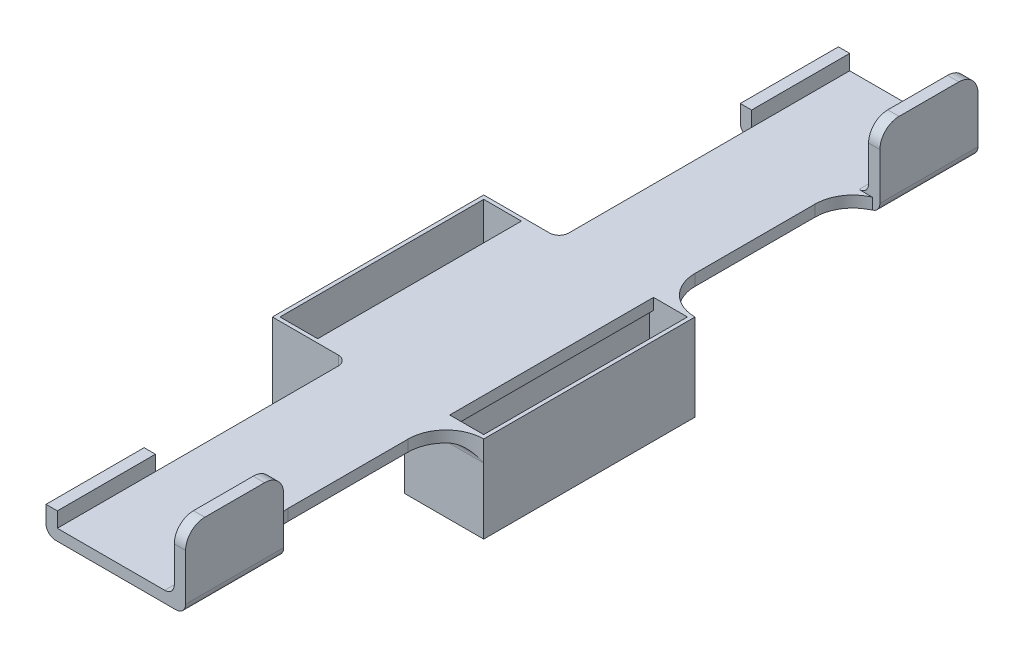
from build123d import *

# Parameters (mm, degrees)
SKETCH1_W                 = 28
SKETCH1_H                 = 28
SKETCH1_W_2               = 27
SKETCH1_H_2               = 27
BOSS_EXTRUDE1_DEPTH       = 5
SKETCH2_W                 = 27
SKETCH2_H                 = 27
BOSS_EXTRUDE2_DEPTH       = 1
SKETCH4_W                 = 7
SKETCH4_H                 = 0.5
CUT_EXTRUDE1_DEPTH        = 4
CUT_EXTRUDE2_DEPTH        = 21.199009877
CUT_EXTRUDE2_DEPTH_BACK   = 21.199009877
SKETCH5_W                 = 5
SKETCH5_H                 = 27
SKETCH7_W                 = 5
SKETCH7_H                 = 27
BOSS_EXTRUDE3_DEPTH       = 4
BOSS_EXTRUDE4_DEPTH       = 5
BOSS_EXTRUDE5_DEPTH       = 5
SKETCH10_W                = 13
SKETCH10_H                = 105
BOSS_EXTRUDE6_DEPTH       = 1.5
SKETCH11_W                = 10
SKETCH11_H                = 28
SKETCH11_W_2              = 5
SKETCH11_H_2              = 27
BOSS_EXTRUDE7_DEPTH       = 1.5
SKETCH12_W                = 3
SKETCH12_H                = 13
BOSS_EXTRUDE8_DEPTH       = 1.5
SKETCH14_W                = 3
SKETCH14_H                = 13
BOSS_EXTRUDE9_DEPTH       = 1.5
FILLET1_R                 = 5
BOSS_EXTRUDE10_DEPTH      = 1
BOSS_EXTRUDE10_DEPTH_BACK = 0.5
SKETCH15_W                = 13
SKETCH15_H                = 10.000000066
FILLET2_R                 = 1.27
FILLET3_R                 = 1.27
FILLET4_R                 = 1.27
FILLET5_R                 = 1.27
SKETCH16_W                = 13
SKETCH16_H                = 3.5
BOSS_EXTRUDE11_DEPTH      = 1.5
FILLET6_R                 = 1.27
FILLET7_R                 = 1.27
FILLET8_R                 = 2.54
CUT_EXTRUDE3_DEPTH        = 1


with BuildPart() as part:
    # Sketch1 → Boss-Extrude1 (new body)
    with BuildSketch(Plane(origin=(0, 0, 0), x_dir=(1, 0, 0), z_dir=(0, 1, 0))):
        Rectangle(SKETCH1_W, SKETCH1_H)
        Rectangle(SKETCH1_W_2, SKETCH1_H_2, mode=Mode.SUBTRACT)
    extrude(amount=BOSS_EXTRUDE1_DEPTH)

    # Sketch4 → Cut-Extrude1 (cut)
    with BuildSketch(Plane.XZ):
        with Locations((0, 13.75)):
            Rectangle(SKETCH4_W, SKETCH4_H)
        with Locations((0, -13.75)):
            Rectangle(SKETCH4_W, SKETCH4_H)
    extrude(amount=-CUT_EXTRUDE1_DEPTH, mode=Mode.SUBTRACT)



with BuildPart() as body_2:
    # Sketch2 → Boss-Extrude2 (new body)
    with BuildSketch(Plane(origin=(0, 5, 0), x_dir=(1, 0, 0), z_dir=(0, 1, 0))):
        Rectangle(SKETCH2_W, SKETCH2_H)
    extrude(amount=-BOSS_EXTRUDE2_DEPTH)

    # Sketch5 → Cut-Extrude2 (cut, two sides: drawn at the far end of the back side and taken through both)
    with BuildSketch(Plane.XZ.offset(-4).offset(-CUT_EXTRUDE2_DEPTH_BACK)):
        with Locations((-11, 0)):
            Rectangle(SKETCH5_W, SKETCH5_H)
        with Locations((11, 0)):
            Rectangle(SKETCH5_W, SKETCH5_H)
    extrude(amount=CUT_EXTRUDE2_DEPTH + CUT_EXTRUDE2_DEPTH_BACK, mode=Mode.SUBTRACT)


with BuildPart() as part_1:
    add(part.part)

    add(body_2.part)  # Boss-Extrude3 merges body 2
    # Sketch7 → Boss-Extrude3 (add)
    with BuildSketch(Plane.XZ.offset(-4)):
        with Locations((-6, 0)):
            Rectangle(SKETCH7_W, SKETCH7_H)
        with Locations((6, 0)):
            Rectangle(SKETCH7_W, SKETCH7_H)
    extrude(amount=BOSS_EXTRUDE3_DEPTH)

    # Sketch8 → Boss-Extrude4 (add)
    with BuildSketch(Plane.XZ):
        Polygon((-13.5, -13.5), (-13.5, 13.5), (-3.5, 13.5), (-3.5, 14), (-14, 14), (-14, -14), (-3.5, -14), (-3.5, -13.5), align=None)
    extrude(amount=BOSS_EXTRUDE4_DEPTH)

    # Sketch9 → Boss-Extrude5 (add)
    with BuildSketch(Plane.XZ):
        Polygon((3.5, 14), (14, 14), (14, -14), (3.5, -14), (3.5, -13.5), (13.5, -13.5), (13.5, 13.5), (3.5, 13.5), align=None)
    extrude(amount=BOSS_EXTRUDE5_DEPTH)

    # Sketch10 → Boss-Extrude6 (add)
    with BuildSketch(Plane(origin=(0, 5, 0), x_dir=(1, 0, 0), z_dir=(0, 1, 0))):
        with Locations((2.5, 0)):
            Rectangle(SKETCH10_W, SKETCH10_H)
    extrude(amount=BOSS_EXTRUDE6_DEPTH)

    # Sketch11 → Boss-Extrude7 (add)
    # profile 1 of 2: a face of its own
    with BuildSketch(Plane(origin=(0, 5, 0), x_dir=(1, 0, 0), z_dir=(0, 1, 0))):
        with Locations((-9, 0)):
            Rectangle(SKETCH11_W, SKETCH11_H)
        with Locations((-11, 0)):
            Rectangle(SKETCH11_W_2, SKETCH11_H_2, mode=Mode.SUBTRACT)
    # profile 2 of 2: a face of its own
    with BuildSketch(Plane(origin=(0, 5, 0), x_dir=(1, 0, 0), z_dir=(0, 1, 0))):
        Polygon((9, 13.5), (9, 14), (14, 14), (14, -14), (9, -14), (9, -13.5), (13.5, -13.5), (13.5, 13.5), align=None)
    extrude(amount=BOSS_EXTRUDE7_DEPTH)

    # Sketch12 → Boss-Extrude8 (add)
    with BuildSketch(Plane(origin=(0, 6.5, 0), x_dir=(1, 0, 0), z_dir=(0, 1, 0))):
        with Locations((10.5, -46)):
            Rectangle(SKETCH12_W, SKETCH12_H)
    extrude(amount=-BOSS_EXTRUDE8_DEPTH)

    # Sketch14 → Boss-Extrude9 (add)
    with BuildSketch(Plane(origin=(0, 6.5, 0), x_dir=(1, 0, 0), z_dir=(0, 1, 0))):
        with Locations((10.5, 46)):
            Rectangle(SKETCH14_W, SKETCH14_H)
    extrude(amount=-BOSS_EXTRUDE9_DEPTH)

    # Fillet1
    # the kernel refuses this fillet: 5 mm, written as the material it adds along each edge
    with BuildSketch(Plane(origin=(9, 6.5, 39.5), x_dir=(0, 0, -1), z_dir=(0, -1, 0))) as fillet1_piece_1:
        with BuildLine():
            CenterArc((4.582575695, 5), FILLET1_R, 203.578178478, 66.421821522)
            Line((0, 3), (-0.091651514, 2.96))
            ThreePointArc((-0.091651514, 2.96), (-0.1, 1.5), (-0.1, 0))
            Line((-0.1, 0), (0, -0.1))
            Line((0, -0.1), (4.582575695, -0.1))
            Line((4.582575695, -0.1), (4.582575695, 0))
        make_face()
    extrude(amount=1.5)
    with BuildSketch(Plane(origin=(9, 5, 14), x_dir=(1, 0, 0), z_dir=(0, 1, 0))) as fillet1_piece_2:
        with BuildLine():
            CenterArc((FILLET1_R, -FILLET1_R), FILLET1_R, 90, 90)
            Line((0, -FILLET1_R), (-FILLET1_R * 0.02, -FILLET1_R))
            Line((-FILLET1_R * 0.02, -FILLET1_R), (-FILLET1_R * 0.02, FILLET1_R * 0.02))
            Line((-FILLET1_R * 0.02, FILLET1_R * 0.02), (FILLET1_R, FILLET1_R * 0.02))
            Line((FILLET1_R, FILLET1_R * 0.02), (FILLET1_R, 0))
        make_face()
    extrude(amount=1.5)
    with BuildSketch(Plane(origin=(9, 5, -14), x_dir=(1, 0, 0), z_dir=(0, 1, 0))) as fillet1_piece_3:
        with BuildLine():
            CenterArc((FILLET1_R, FILLET1_R), FILLET1_R, 180, 90)
            Line((0, FILLET1_R), (-FILLET1_R * 0.02, FILLET1_R))
            Line((-FILLET1_R * 0.02, FILLET1_R), (-FILLET1_R * 0.02, -FILLET1_R * 0.02))
            Line((-FILLET1_R * 0.02, -FILLET1_R * 0.02), (FILLET1_R, -FILLET1_R * 0.02))
            Line((FILLET1_R, -FILLET1_R * 0.02), (FILLET1_R, 0))
        make_face()
    extrude(amount=1.5)
    with BuildSketch(Plane(origin=(9, 6.5, -39.5), x_dir=(0, 0, 1), z_dir=(0, -1, 0))) as fillet1_piece_4:
        with BuildLine():
            CenterArc((4.582575695, -5), FILLET1_R, 90, 66.421821522)
            Line((0, -3), (-0.091651514, -2.96))
            ThreePointArc((-0.091651514, -2.96), (-0.1, -1.5), (-0.1, 0))
            Line((-0.1, 0), (0, 0.1))
            Line((0, 0.1), (4.582575695, 0.1))
            Line((4.582575695, 0.1), (4.582575695, 0))
        make_face()
    extrude(amount=1.5)

    # Sketch15 → Boss-Extrude10 (add, two sides: drawn at the far end of the back side and taken through both)
    with BuildSketch(Plane(origin=(12, 0, 0), x_dir=(0, 0, -1), z_dir=(1, 0, 0)).offset(-BOSS_EXTRUDE10_DEPTH_BACK)):
        with Locations((46, 10.000000033)):
            Rectangle(SKETCH15_W, SKETCH15_H)
        with Locations((-46, 10.000000033)):
            Rectangle(SKETCH15_W, SKETCH15_H)
    extrude(amount=BOSS_EXTRUDE10_DEPTH + BOSS_EXTRUDE10_DEPTH_BACK)

    # Fillet2
    fillet2_edges = [part_1.edges().sort_by_distance(p)[0] for p in [
        (11.5, 6.5, -46),
        (11.5, 6.5, 46),
    ]]
    fillet(fillet2_edges, radius=FILLET2_R)

    # Fillet3
    # the kernel refuses this fillet: 1.27 mm, written as the material it adds along each edge
    with BuildSketch(Plane(origin=(-4, 5, 14), x_dir=(0, 0, 1), z_dir=(1, 0, 0))) as fillet3_piece_1_section:
        with BuildLine():
            CenterArc((FILLET3_R, FILLET3_R), FILLET3_R, 180, 90)
            Line((0, FILLET3_R), (0, 0))
            Line((0, 0), (FILLET3_R, 0))
        make_face()
    fillet3_piece_1 = extrude(amount=18, mode=Mode.PRIVATE)
    fillet3_piece_1 = fillet3_piece_1 - Plane(origin=(14, 4.722255872, 19), x_dir=(1, 0, 0), z_dir=(0, -1, 0)) * Cylinder(5, 42, mode=Mode.PRIVATE)
    fillet3_piece_1 = split(fillet3_piece_1, bisect_by=Plane(origin=(-3.75, 4, 14.285759195), z_dir=(0, 1, 0)), keep=Keep.TOP, mode=Mode.PRIVATE)
    add(fillet3_piece_1)
    with BuildSketch(Plane(origin=(-4, 5, 14), x_dir=(0, 0, 1), z_dir=(1, 0, 0))) as fillet3_piece_2_section:
        with BuildLine():
            CenterArc((FILLET3_R, FILLET3_R), FILLET3_R, 180, 90)
            Line((0, FILLET3_R), (0, 0))
            Line((0, 0), (FILLET3_R, 0))
        make_face()
    fillet3_piece_2 = extrude(amount=21.175, mode=Mode.PRIVATE)
    fillet3_piece_2 = split(fillet3_piece_2, bisect_by=Plane(origin=(-3.5, 3.932655267, 14.008692454), z_dir=(-1, 0, 0)), keep=Keep.TOP, mode=Mode.PRIVATE)
    add(fillet3_piece_2)
    with BuildSketch(Plane(origin=(-7.175, 5, 14), x_dir=(0, 0, 1), z_dir=(1, 0, 0))) as fillet3_piece_3_section:
        with BuildLine():
            CenterArc((FILLET3_R, FILLET3_R), FILLET3_R, 180, 90)
            Line((0, FILLET3_R), (0, 0))
            Line((0, 0), (FILLET3_R, 0))
        make_face()
    fillet3_piece_3 = extrude(amount=21.175, mode=Mode.PRIVATE)
    fillet3_piece_3 = fillet3_piece_3 - Plane(origin=(14, 3.932300045, 19), x_dir=(1, 0, 0), z_dir=(0, -1, 0)) * Cylinder(5, 48, mode=Mode.PRIVATE)
    fillet3_piece_3 = split(fillet3_piece_3, bisect_by=Plane(origin=(3.5, 3.932300045, 14.008616185), z_dir=(1, 0, 0)), keep=Keep.TOP, mode=Mode.PRIVATE)
    add(fillet3_piece_3)
    with BuildSketch(Plane(origin=(14, 5, -14), x_dir=(0, 0, -1), z_dir=(-1, 0, 0))) as fillet3_piece_4_section:
        with BuildLine():
            CenterArc((FILLET3_R, FILLET3_R), FILLET3_R, 180, 90)
            Line((0, FILLET3_R), (0, 0))
            Line((0, 0), (FILLET3_R, 0))
        make_face()
    fillet3_piece_4 = extrude(amount=18, mode=Mode.PRIVATE)
    fillet3_piece_4 = fillet3_piece_4 - Plane(origin=(14, 4.711484111, -19), x_dir=(1, 0, 0), z_dir=(0, -1, 0)) * Cylinder(5, 42, mode=Mode.PRIVATE)
    fillet3_piece_4 = split(fillet3_piece_4, bisect_by=Plane(origin=(8.027122346, 4, -14.26821747), z_dir=(0, 1, 0)), keep=Keep.TOP, mode=Mode.PRIVATE)
    add(fillet3_piece_4)
    with BuildSketch(Plane(origin=(14, 5, -14), x_dir=(0, 0, -1), z_dir=(-1, 0, 0))) as fillet3_piece_5_section:
        with BuildLine():
            CenterArc((FILLET3_R, FILLET3_R), FILLET3_R, 180, 90)
            Line((0, FILLET3_R), (0, 0))
            Line((0, 0), (FILLET3_R, 0))
        make_face()
    fillet3_piece_5 = extrude(amount=21.175, mode=Mode.PRIVATE)
    fillet3_piece_5 = fillet3_piece_5 - Plane(origin=(14, 3.932300045, -19), x_dir=(1, 0, 0), z_dir=(0, -1, 0)) * Cylinder(5, 48, mode=Mode.PRIVATE)
    fillet3_piece_5 = split(fillet3_piece_5, bisect_by=Plane(origin=(3.5, 3.932300045, -14.008616185), z_dir=(1, 0, 0)), keep=Keep.TOP, mode=Mode.PRIVATE)
    add(fillet3_piece_5)
    with BuildSketch(Plane(origin=(17.175, 5, -14), x_dir=(0, 0, -1), z_dir=(-1, 0, 0))) as fillet3_piece_6_section:
        with BuildLine():
            CenterArc((FILLET3_R, FILLET3_R), FILLET3_R, 180, 90)
            Line((0, FILLET3_R), (0, 0))
            Line((0, 0), (FILLET3_R, 0))
        make_face()
    fillet3_piece_6 = extrude(amount=21.175, mode=Mode.PRIVATE)
    fillet3_piece_6 = split(fillet3_piece_6, bisect_by=Plane(origin=(-3.5, 3.932655267, -14.008692454), z_dir=(-1, 0, 0)), keep=Keep.TOP, mode=Mode.PRIVATE)
    add(fillet3_piece_6)

    # Fillet4
    fillet4_edges = [part_1.edges().sort_by_distance(p)[0] for p in [
        (-3.5, 0, 0),
        (3.5, 0, 0),
        (-8.5, 0, 0),
        (8.5, 0, 0),
    ]]
    fillet(fillet4_edges, radius=FILLET4_R)

    # Fillet5
    fillet5_edges = [part_1.edges().sort_by_distance(p)[0] for p in [
        (-4, 5.115, -14),
        (-4, 5.115, 14),
    ]]
    fillet(fillet5_edges, radius=FILLET5_R)

    # Sketch16 → Boss-Extrude11 (add)
    with BuildSketch(Plane.ZY.offset(4)):
        with Locations((-46, 6.75)):
            Rectangle(SKETCH16_W, SKETCH16_H)
        with Locations((46, 6.75)):
            Rectangle(SKETCH16_W, SKETCH16_H)
    extrude(amount=BOSS_EXTRUDE11_DEPTH)

    # Fillet6
    fillet6_edges = [part_1.edges().sort_by_distance(p)[0] for p in [
        (-5.5, 5, 46),
        (-5.5, 5, -46),
    ]]
    fillet(fillet6_edges, radius=FILLET6_R)

    # Fillet7
    fillet7_edges = [part_1.edges().sort_by_distance(p)[0] for p in [
        (13, 5, 46),
        (13, 5, -46),
    ]]
    fillet(fillet7_edges, radius=FILLET7_R)

    # Fillet8
    fillet8_edges = [part_1.edges().sort_by_distance(p)[0] for p in [
        (12.25, 15.000000066, -52.5),
        (12.25, 15.000000066, -39.5),
        (12.25, 15.000000066, 39.5),
        (12.25, 15.000000066, 52.5),
    ]]
    fillet(fillet8_edges, radius=FILLET8_R)

    # Sketch17 → Cut-Extrude3 (cut)
    with BuildSketch(Plane.XZ.offset(-4)):
        Polygon((-2, 14.029032635), (-2, -14.029032635), (-2, -17.474025738), (2, -17.474025738), (2, -14.029032635), (2, 14.029032635), (2, 17.175749071), (-2, 17.175749071), align=None)
    extrude(amount=-CUT_EXTRUDE3_DEPTH, mode=Mode.SUBTRACT)


solid = part_1.part
